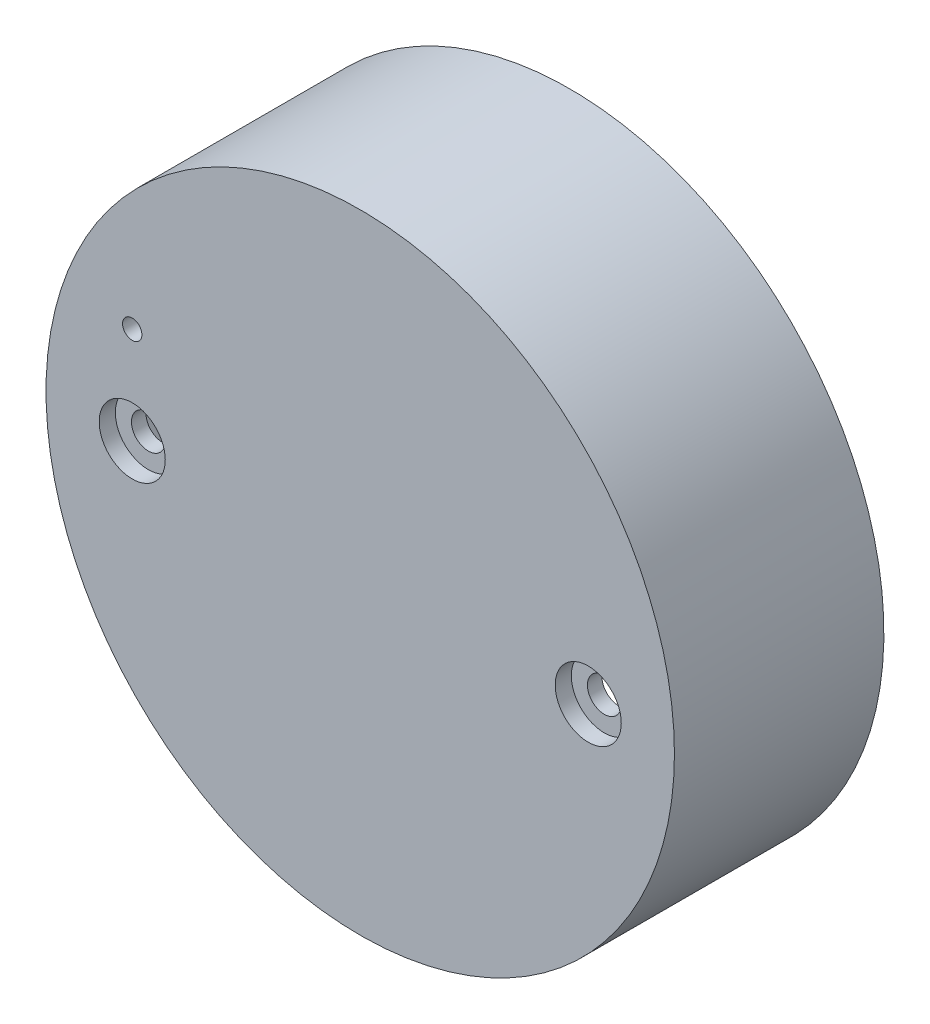
from build123d import *

# Parameters (mm, degrees)
SKETCH_2_R          = 19.5
EXTRUDE_1_DEPTH     = 13
CUT_EXTRUDE_1_DEPTH = 1.5
SKETCH_4_R          = 18.3
CUT_EXTRUDE_2_DEPTH = 11.1
SKETCH_5_R          = 1.05
SKETCH_5_R_2        = 0.6
CUT_EXTRUDE_3_DEPTH = 41.284008974
SKETCH_6_R          = 2.05
CUT_EXTRUDE_4_DEPTH = 1
SKETCH_8_W          = 8.75
SKETCH_8_H          = 7.3
CUT_EXTRUDE_5_DEPTH = 3.25


with BuildPart() as part:
    # 草图2 → 凸台-拉伸1 (new body)
    with BuildSketch(Plane.XY):
        with Locations((5.210280057, 9.537965238)):
            Circle(SKETCH_2_R)
    extrude(amount=EXTRUDE_1_DEPTH)

    # 草图3 → 切除-拉伸1 (cut)
    with BuildSketch(Plane.XY):
        with BuildLine():
            ThreePointArc((-2.089466108, -9.474373158), (5.210280057, -10.827576871), (12.510026223, -9.474373158))
            add(Edge.make_bspline(
                [(12.510026223, -9.474373158), (12.542948952, -8.674555972), (12.802081824, -7.965268064), (13.798852187, -6.666991519), (14.542722505, -6.079743438), (15.544339227, -5.564922601)],
                knots=[0, 0, 0, 0, 0.5, 0.5, 1, 1, 1, 1], degree=3))
            ThreePointArc((15.544339227, -5.564922601), (5.210280058, 27.837965238), (-5.123779113, -5.564922601))
            add(Edge.make_bspline(
                [(-5.123779113, -5.564922601), (-4.122162391, -6.079743437), (-3.378292072, -6.666991518), (-2.381521709, -7.965268064), (-2.122388837, -8.674555972), (-2.089466108, -9.474373158)],
                knots=[0, 0, 0, 0, 0.5, 0.5, 1, 1, 1, 1], degree=3))
        make_face()
    extrude(amount=CUT_EXTRUDE_1_DEPTH, mode=Mode.SUBTRACT)

    # 草图4 → 切除-拉伸2 (cut)
    with BuildSketch(Plane.XY):
        with Locations((5.210280057, 9.537965238)):
            Circle(SKETCH_4_R)
    extrude(amount=CUT_EXTRUDE_2_DEPTH, mode=Mode.SUBTRACT)

    # 草图5 → 切除-拉伸3 (cut, through all)
    with BuildSketch(Plane.XY):
        with Locations((19.360280057, 9.537965238)):
            Circle(SKETCH_5_R)
        with Locations((-8.939719943, 9.537965238)):
            Circle(SKETCH_5_R)
        with Locations((-8.939719943, 15.537965238)):
            Circle(SKETCH_5_R_2)
    extrude(amount=CUT_EXTRUDE_3_DEPTH, mode=Mode.SUBTRACT)

    # 草图6 → 切除-拉伸4 (cut)
    with BuildSketch(Plane.XY.offset(13)):
        with Locations((-8.939719943, 9.537965238)):
            Circle(SKETCH_6_R)
        with Locations((19.360280057, 9.537965238)):
            Circle(SKETCH_6_R)
    extrude(amount=-CUT_EXTRUDE_4_DEPTH, mode=Mode.SUBTRACT)

    # 草图8 → 切除-拉伸5 (cut)
    with BuildSketch(Plane(origin=(0, 0, 3.1), x_dir=(-1, 0, 0), z_dir=(0, 0, -1))):
        with Locations((-5.210300293, -6.312034762)):
            Rectangle(SKETCH_8_W, SKETCH_8_H)
    extrude(amount=-CUT_EXTRUDE_5_DEPTH, mode=Mode.SUBTRACT)


solid = part.part
